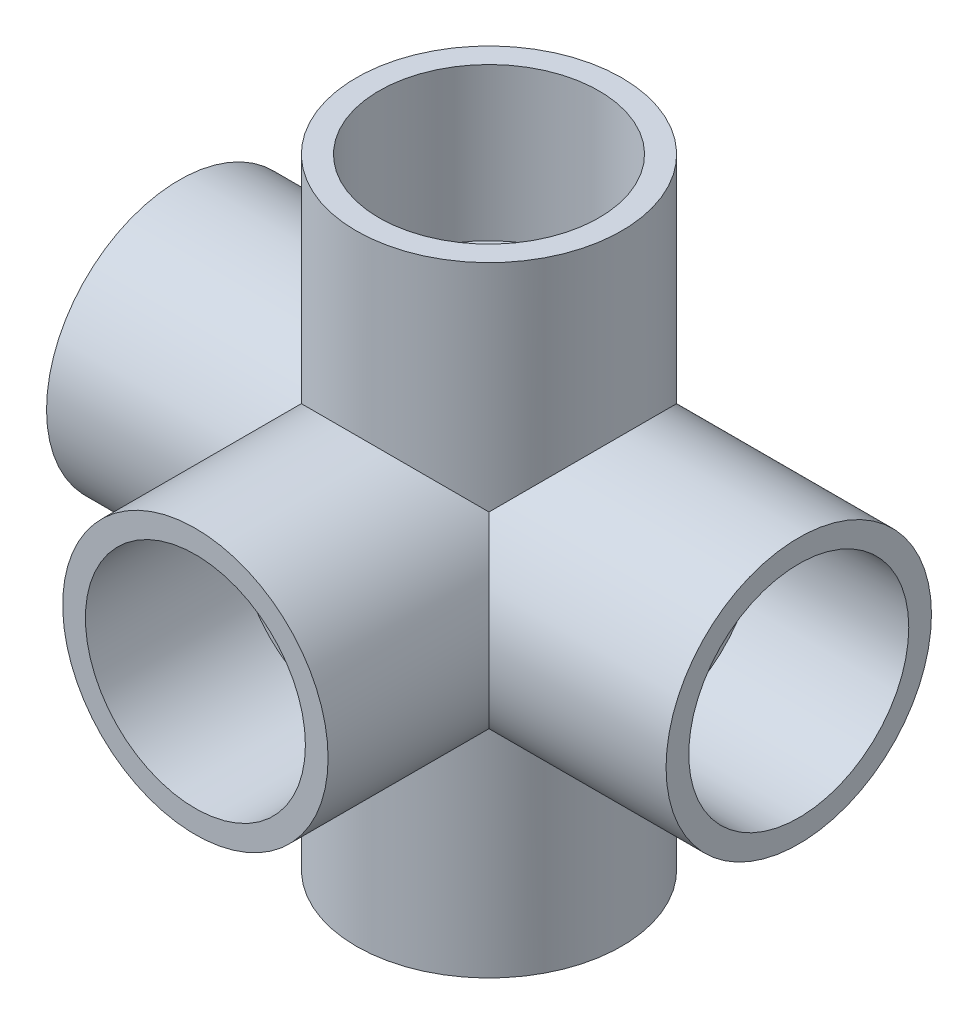
from build123d import *

# Parameters (mm, degrees)
SKETCH_1_R               = 19.3
SKETCH_1_R_2             = 13.6
EXTRUDE_1_DEPTH          = 45.05
SKETCH_3_R               = 19.3
SKETCH_3_R_2             = 13.6
EXTRUDE_3_DEPTH          = 45.05
SKETCH_2_R               = 19.3
SKETCH_2_R_2             = 13.6
EXTRUDE_2_DEPTH          = 42.7
CUT_EXTRUDE_1_DEPTH      = 77.696121327
CUT_EXTRUDE_1_DEPTH_BACK = 77.696121327
SKETCH_1_13_R            = 13.6
CUT_EXTRUDE_START        = -19.3000001
CUT_EXTRUDE_2_OUTLINE_R  = 13.6
CUT_EXTRUDE_2_DEPTH      = 38.6000002
CUT_EXTRUDE_START_2      = 9.616652
SKETCH_2_8_R             = 13.6
CUT_EXTRUDE_3_DEPTH      = 9.683348
CUT_EXTRUDE_START_3      = -45.05
SKETCH_1_15_R            = 16
CUT_EXTRUDE_4_DEPTH      = 22.2
CUT_EXTRUDE_START_4      = 22.85
SKETCH_1_16_R            = 16
CUT_EXTRUDE_5_DEPTH      = 22.2
SKETCH_3_9_R             = 16
CUT_EXTRUDE_6_DEPTH      = 22.2
SKETCH_3_10_R            = 16
CUT_EXTRUDE_7_DEPTH      = 22.2
CUT_EXTRUDE_START_5      = 20.5
SKETCH_2_9_R             = 16
SKETCH_2_9_R_2           = 13.6
CUT_EXTRUDE_8_DEPTH      = 22.2


# Read off the part's stored shape, not the designer's step: 切除-拉伸2
with BuildPart() as part:
    # 草图1 → 凸台-拉伸1 (new, symmetric)
    with BuildSketch(Plane(origin=(0, 0, 0), x_dir=(1, 0, 0), z_dir=(0, 1, 0))):
        with Locations(Location((0, 0, 0), (0, 0, 270))):
            Circle(SKETCH_1_R)
        with Locations(Location((0, 0, 0), (0, 0, 270))):
            Circle(SKETCH_1_R_2, mode=Mode.SUBTRACT)
    extrude(amount=EXTRUDE_1_DEPTH, both=True)

    # 草图3 → 凸台-拉伸3 (add, symmetric)
    with BuildSketch(Plane(origin=(0, 0, 0), x_dir=(0, 0, -1), z_dir=(1, 0, 0))):
        Circle(SKETCH_3_R)
        with Locations(Location((0, 0, 0), (0, 0, 135.000000053))):
            Circle(SKETCH_3_R_2, mode=Mode.SUBTRACT)
    extrude(amount=EXTRUDE_3_DEPTH, both=True)

    # 草图2 → 凸台-拉伸2 (add)
    with BuildSketch(Plane.XY):
        with Locations(Location((0, 0, 0), (0, 0, 225))):
            Circle(SKETCH_2_R)
        with Locations(Location((0, 0, 0), (0, 0, 224.999996881))):
            Circle(SKETCH_2_R_2, mode=Mode.SUBTRACT)
    extrude(amount=EXTRUDE_2_DEPTH)

    # 草图1<13> → 切除-拉伸1 (cut, two sides: drawn at the far end of the back side and taken through both)
    with BuildSketch(Plane(origin=(0, 0, 0), x_dir=(1, 0, 0), z_dir=(0, 1, 0)).offset(-CUT_EXTRUDE_1_DEPTH_BACK)):
        with Locations(Location((0, 0, 0), (0, 0, 270))):
            Circle(SKETCH_1_13_R)
    extrude(amount=CUT_EXTRUDE_1_DEPTH + CUT_EXTRUDE_1_DEPTH_BACK, mode=Mode.SUBTRACT)

    # 切除-拉伸2 outline → 切除-拉伸2 (cut)
    with BuildSketch(Plane(origin=(0, 0, 0), x_dir=(0, 0, -1), z_dir=(1, 0, 0)).offset(CUT_EXTRUDE_START)):
        Circle(CUT_EXTRUDE_2_OUTLINE_R)
    extrude(amount=CUT_EXTRUDE_2_DEPTH, mode=Mode.SUBTRACT)

    # 草图2<8> → 切除-拉伸3 (cut)
    with BuildSketch(Plane.XY.offset(CUT_EXTRUDE_START_2)):
        with Locations(Location((0, 0, 0), (0, 0, 225))):
            Circle(SKETCH_2_8_R)
    extrude(amount=CUT_EXTRUDE_3_DEPTH, mode=Mode.SUBTRACT)

    # 草图1<15> → 切除-拉伸4 (cut)
    with BuildSketch(Plane(origin=(0, 0, 0), x_dir=(1, 0, 0), z_dir=(0, 1, 0)).offset(CUT_EXTRUDE_START_3)):
        with Locations(Location((0, 0, 0), (0, 0, 270))):
            Circle(SKETCH_1_15_R)
    extrude(amount=CUT_EXTRUDE_4_DEPTH, mode=Mode.SUBTRACT)

    # 草图1<16> → 切除-拉伸5 (cut)
    with BuildSketch(Plane(origin=(0, 0, 0), x_dir=(1, 0, 0), z_dir=(0, 1, 0)).offset(CUT_EXTRUDE_START_4)):
        with Locations(Location((0, 0, 0), (0, 0, 270))):
            Circle(SKETCH_1_16_R)
    extrude(amount=CUT_EXTRUDE_5_DEPTH, mode=Mode.SUBTRACT)

    # 草图3<9> → 切除-拉伸6 (cut)
    with BuildSketch(Plane(origin=(0, 0, 0), x_dir=(0, 0, -1), z_dir=(1, 0, 0)).offset(CUT_EXTRUDE_START_3)):
        Circle(SKETCH_3_9_R)
    extrude(amount=CUT_EXTRUDE_6_DEPTH, mode=Mode.SUBTRACT)

    # 草图3<10> → 切除-拉伸7 (cut)
    with BuildSketch(Plane(origin=(0, 0, 0), x_dir=(0, 0, -1), z_dir=(1, 0, 0)).offset(CUT_EXTRUDE_START_4)):
        Circle(SKETCH_3_10_R)
    extrude(amount=CUT_EXTRUDE_7_DEPTH, mode=Mode.SUBTRACT)

    # 草图2<9> → 切除-拉伸8 (cut)
    with BuildSketch(Plane.XY.offset(CUT_EXTRUDE_START_5)):
        Circle(SKETCH_2_9_R)
        with Locations(Location((0, 0, 0), (0, 0, 225))):
            Circle(SKETCH_2_9_R_2, mode=Mode.SUBTRACT)
    extrude(amount=CUT_EXTRUDE_8_DEPTH, mode=Mode.SUBTRACT)


solid = part.part
